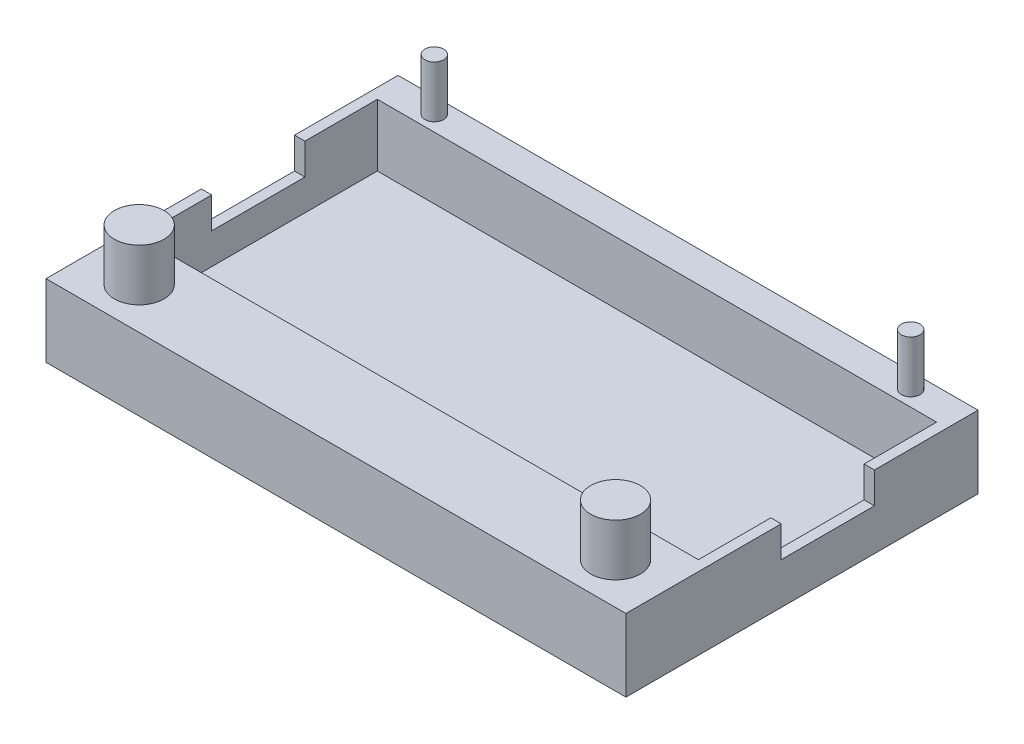
from build123d import *

# Parameters (mm, degrees)
SKETCH_1_W      = 56
SKETCH_1_H      = 32
EXTRUDE_1_DEPTH = 1
SKETCH_2_W      = 56
SKETCH_2_H      = 32
SKETCH_2_W_2    = 54
SKETCH_2_H_2    = 23
EXTRUDE_3_DEPTH = 3
EXTRUDE_7_DEPTH = 3
SKETCH_9_W      = 56
SKETCH_9_H      = 2
EXTRUDE_9_DEPTH = 7
SKETCH_7_R      = 2.4
SKETCH_7_R_2    = 0.9
EXTRUDE_8_DEPTH = 5


with BuildPart() as part:
    # 草图1 → 凸台-拉伸1 (new body)
    with BuildSketch(Plane(origin=(0, 0, 0), x_dir=(1, 0, 0), z_dir=(0, 1, 0))):
        with Locations((-28, 16)):
            Rectangle(SKETCH_1_W, SKETCH_1_H)
    extrude(amount=EXTRUDE_1_DEPTH)

    # 草图2 → 凸台-拉伸3 (add)
    with BuildSketch(Plane(origin=(0, 1, 0), x_dir=(1, 0, 0), z_dir=(0, 1, 0))):
        with Locations((-28, 16)):
            Rectangle(SKETCH_2_W, SKETCH_2_H)
        with Locations((-28, 19.5)):
            Rectangle(SKETCH_2_W_2, SKETCH_2_H_2, mode=Mode.SUBTRACT)
    extrude(amount=EXTRUDE_3_DEPTH)

    # 草图5 → 凸台-拉伸7 (add)
    with BuildSketch(Plane(origin=(0, 4, 0), x_dir=(1, 0, 0), z_dir=(0, 1, 0))):
        Polygon((-56, 15), (-56, 0), (0, 0), (0, 15), (-1, 15), (-1, 8), (-55, 8), (-55, 15), align=None)
        Polygon((-56, 32), (-56, 24), (-55, 24), (-55, 31), (-1, 31), (-1, 24), (0, 24), (0, 32), align=None)
    extrude(amount=EXTRUDE_7_DEPTH)

    # 草图9 → 凸台-拉伸9 (add)
    with BuildSketch(Plane(origin=(0, 0, 0), x_dir=(1, 0, 0), z_dir=(0, 1, 0))):
        with Locations((-28, 33)):
            Rectangle(SKETCH_9_W, SKETCH_9_H)
    extrude(amount=EXTRUDE_9_DEPTH)

    # 草图7 → 凸台-拉伸8 (add)
    with BuildSketch(Plane(origin=(0, 7, 0), x_dir=(1, 0, 0), z_dir=(0, 1, 0))):
        with Locations((-51, 4)):
            Circle(SKETCH_7_R)
        with Locations((-5, 4)):
            Circle(SKETCH_7_R)
        with Locations((-51, 32.5)):
            Circle(SKETCH_7_R_2)
        with Locations((-5, 32.5)):
            Circle(SKETCH_7_R_2)
    extrude(amount=EXTRUDE_8_DEPTH)


solid = part.part
